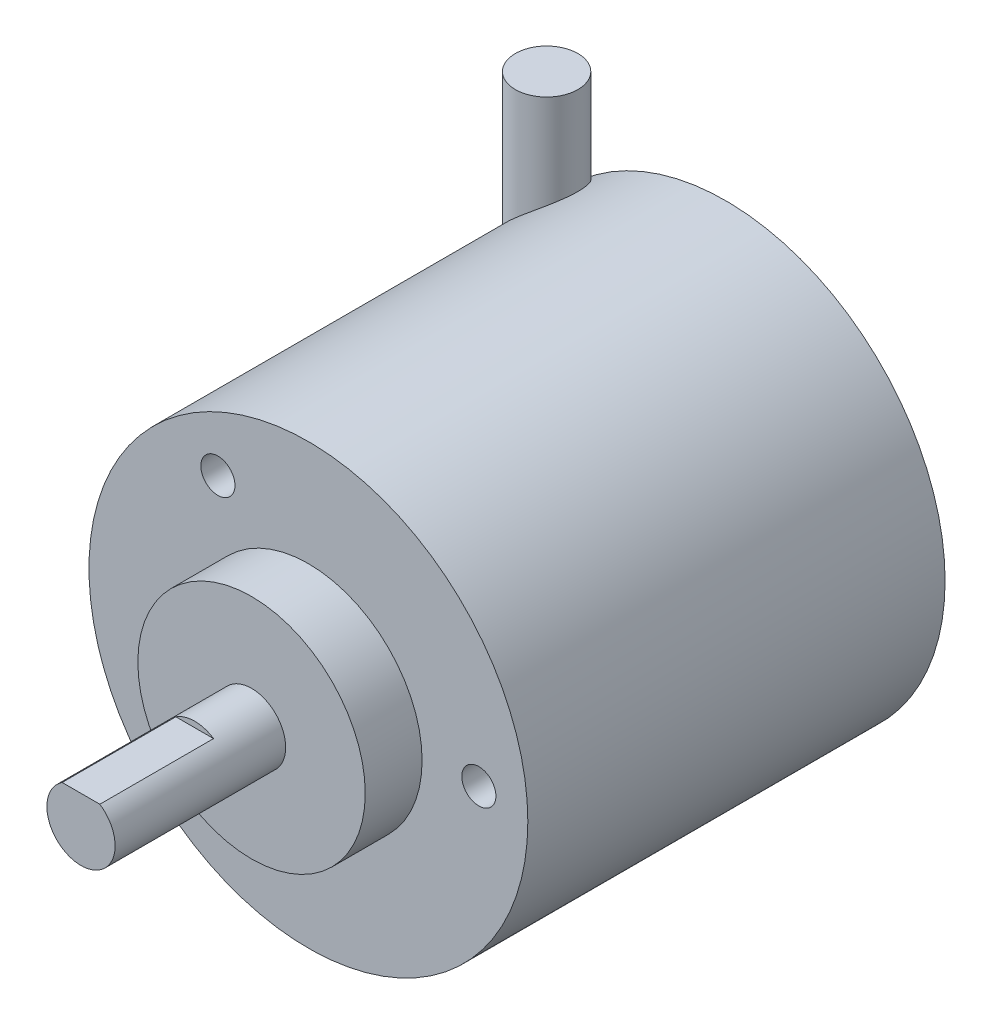
from build123d import *

# Parameters (mm, degrees)
SKETCH1_R           = 19.3
BOSS_EXTRUDE1_DEPTH = 36.7
SKETCH3_R           = 10
BOSS_EXTRUDE2_DEPTH = 5
SKETCH4_R           = 3
BOSS_EXTRUDE3_DEPTH = 15
SKETCH8_R           = 2.75
BOSS_EXTRUDE4_DEPTH = 15
SKETCH9_R           = 2.75
BOSS_EXTRUDE5_DEPTH = 5
SKETCH5_R           = 1.5
CUT_EXTRUDE1_DEPTH  = 10
CUT_EXTRUDE2_START  = -10
CUT_EXTRUDE2_DEPTH  = 10


with BuildPart() as part:
    # Sketch1 → Boss-Extrude1 (new body)
    with BuildSketch(Plane.XY):
        with Locations((-14.127422454, 5.37928778)):
            Circle(SKETCH1_R)
    extrude(amount=BOSS_EXTRUDE1_DEPTH)

    # Sketch3 → Boss-Extrude2 (add)
    with BuildSketch(Plane.XY.offset(36.7)):
        with Locations((-14.127422454, 5.37928778)):
            Circle(SKETCH3_R)
    extrude(amount=BOSS_EXTRUDE2_DEPTH)

    # Sketch4 → Boss-Extrude3 (add)
    with BuildSketch(Plane.XY.offset(41.7)):
        with Locations((-14.127422454, 5.37928778)):
            Circle(SKETCH4_R)
    extrude(amount=BOSS_EXTRUDE3_DEPTH)



with BuildPart() as body_2:
    # Sketch8 → Boss-Extrude4 (new body)
    with BuildSketch(Plane(origin=(0, 24.67928778, 0), x_dir=(1, 0, 0), z_dir=(0, 1, 0))):
        with Locations((-26.832117877, -3.04260895)):
            Circle(SKETCH8_R)
    extrude(amount=-BOSS_EXTRUDE4_DEPTH)


with BuildPart() as part_1:
    add(part.part)

    add(body_2.part)  # Boss-Extrude5 merges body 2
    # Sketch9 → Boss-Extrude5 (add)
    with BuildSketch(Plane(origin=(0, 24.67928778, 0), x_dir=(1, 0, 0), z_dir=(0, 1, 0))):
        with Locations((-26.832117877, -3.04260895)):
            Circle(SKETCH9_R)
    extrude(amount=BOSS_EXTRUDE5_DEPTH)

    # Sketch5 → Cut-Extrude1 (cut)
    with BuildSketch(Plane.XY.offset(36.7)):
        with Locations((0.862954929, 5.91648973)):
            Circle(SKETCH5_R)
        with Locations((-21.15738061, -7.87136082)):
            Circle(SKETCH5_R)
        with Locations((-22.08784168, 18.092734431)):
            Circle(SKETCH5_R)
    extrude(amount=-CUT_EXTRUDE1_DEPTH, mode=Mode.SUBTRACT)

    # Sketch10 → Cut-Extrude2 (cut)
    with BuildSketch(Plane.XY.offset(56.7).offset(CUT_EXTRUDE2_START)):
        with BuildLine():
            ThreePointArc((-12.469110059, 7.87928778), (-14.127422454, 8.37928778), (-15.785734849, 7.87928778))
            Line((-15.785734849, 7.87928778), (-12.469110059, 7.87928778))
        make_face()
    extrude(amount=CUT_EXTRUDE2_DEPTH, mode=Mode.SUBTRACT)


solid = part_1.part
